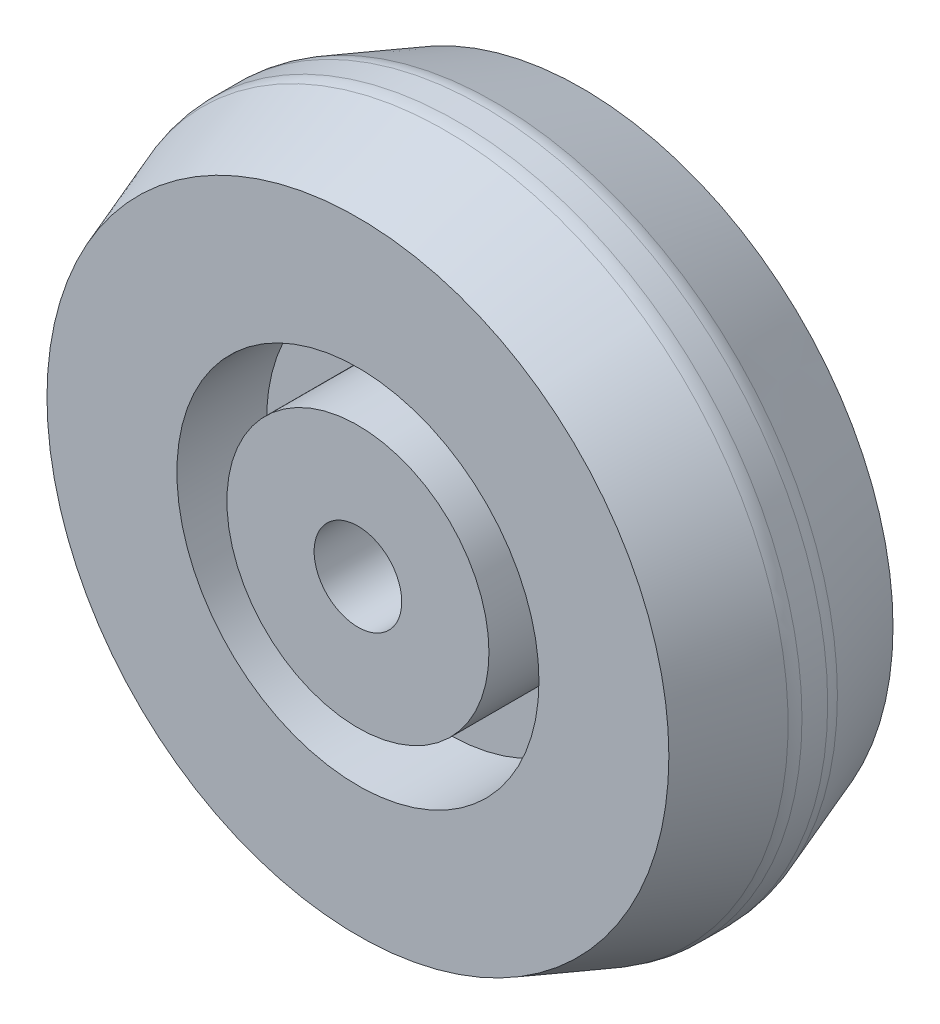
from build123d import *

# Parameters (mm, degrees)
SKETCH1_R           = 25.4
BOSS_EXTRUDE1_DEPTH = 8.255
FILLET1_R           = 2.54
SKETCH3_R           = 3.2258
CUT_EXTRUDE1_DEPTH  = 40.533531954
SKETCH4_R           = 13.335
SKETCH4_R_2         = 9.652
CUT_EXTRUDE2_DEPTH  = 6.604


# Read off the part's stored shape, not the designer's step: Cut-Revolve-Thin6
with BuildPart() as part:
    # Sketch1 → Boss-Extrude1 (new, symmetric)
    with BuildSketch(Plane.XY):
        Circle(SKETCH1_R)
    extrude(amount=BOSS_EXTRUDE1_DEPTH, both=True)

    # Cut-Revolve-Thin6 outline → Cut-Revolve-Thin6 (revolve, cut)
    with BuildSketch(Plane.XZ):
        Polygon((25.4, 8.255), (22.903425716, 8.255), (25.4, 1.395718529), align=None)
        Polygon((25.4, -8.255), (25.4, -1.395718529), (22.903425716, -8.255), align=None)
    revolve(axis=Axis((0, 0, 0), (0, 0, 1)), mode=Mode.SUBTRACT)

    # Fillet1
    fillet1_edges = [part.edges().sort_by_distance(p)[0] for p in [
        (-25.4, 0, -1.395718529),
        (-25.4, 0, 1.395718529),
    ]]
    fillet(fillet1_edges, radius=FILLET1_R)

    # Sketch3 → Cut-Extrude1 (cut, through all)
    with BuildSketch(Plane.XY.offset(8.255)):
        Circle(SKETCH3_R)
    extrude(amount=-CUT_EXTRUDE1_DEPTH, mode=Mode.SUBTRACT)

    # Sketch4 → Cut-Extrude2 (cut)
    with BuildSketch(Plane.XY.offset(8.255)):
        Circle(SKETCH4_R)
        Circle(SKETCH4_R_2, mode=Mode.SUBTRACT)
    cut_extrude2 = extrude(amount=-CUT_EXTRUDE2_DEPTH, mode=Mode.SUBTRACT)

    # Mirror1: Cut-Extrude2 across plane
    add(cut_extrude2.mirror(Plane.XY), mode=Mode.SUBTRACT)


solid = part.part
